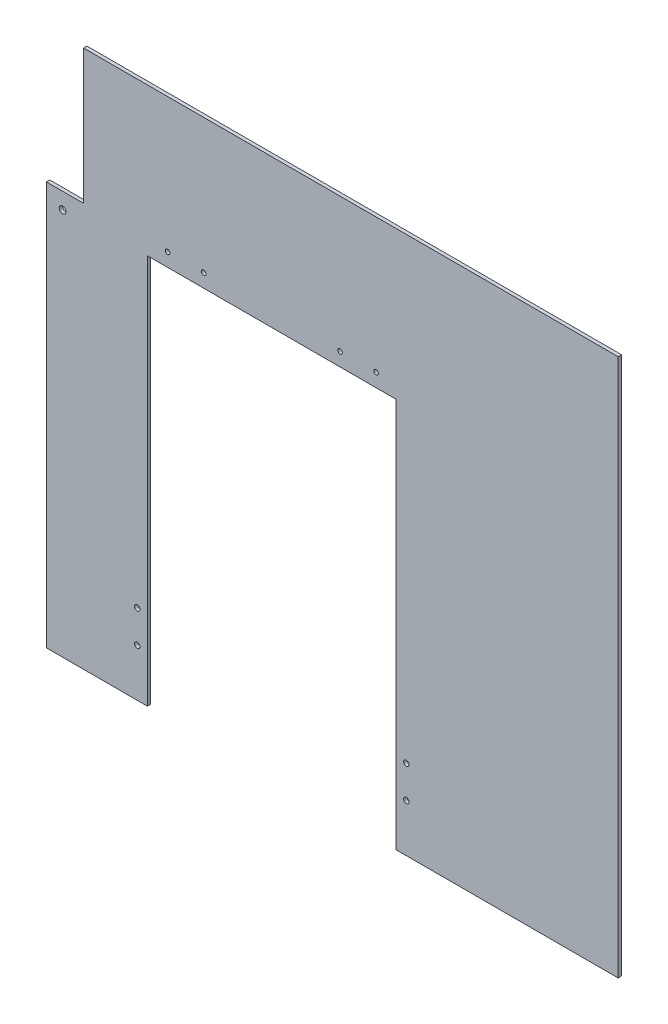
from build123d import *

# Parameters (mm, degrees)
SKETCH1_W           = 539.75
SKETCH1_H           = 508
BOSS_EXTRUDE1_DEPTH = 3.175
SKETCH2_R           = 2.54
SKETCH2_R_2         = 3.175
SKETCH2_W           = 234.95
SKETCH2_H           = 368.3
CUT_EXTRUDE1_DEPTH  = 44.45
SKETCH3_W           = 34.925
SKETCH3_H           = 127
CUT_EXTRUDE2_DEPTH  = 742.218013222
SKETCH4_R           = 2.159
CUT_EXTRUDE3_DEPTH  = 742.218013222


with BuildPart() as part:
    # Sketch1 → Boss-Extrude1 (new body)
    with BuildSketch(Plane.XY):
        with Locations((269.875, 254)):
            Rectangle(SKETCH1_W, SKETCH1_H)
    extrude(amount=BOSS_EXTRUDE1_DEPTH)

    # Sketch2 → Cut-Extrude1 (cut)
    with BuildSketch(Plane(origin=(0, 0, 0), x_dir=(-1, 0, 0), z_dir=(0, 0, -1))):
        with Locations((-339.725, 45.085)):
            Circle(SKETCH2_R)
        with Locations((-85.725, 45.085)):
            Circle(SKETCH2_R)
        with Locations((-15.24, 365.76)):
            Circle(SKETCH2_R_2)
        with Locations((-339.725, 75.565)):
            Circle(SKETCH2_R)
        with Locations((-85.725, 75.565)):
            Circle(SKETCH2_R)
        with Locations((-212.725, 184.15)):
            Rectangle(SKETCH2_W, SKETCH2_H)
    extrude(amount=-CUT_EXTRUDE1_DEPTH, mode=Mode.SUBTRACT)

    # Sketch3 → Cut-Extrude2 (cut, through all)
    with BuildSketch(Plane(origin=(0, 0, 0), x_dir=(-1, 0, 0), z_dir=(0, 0, -1))):
        with Locations((-17.4625, 444.5)):
            Rectangle(SKETCH3_W, SKETCH3_H)
    extrude(amount=-CUT_EXTRUDE2_DEPTH, mode=Mode.SUBTRACT)

    # Sketch4 → Cut-Extrude3 (cut, through all)
    with BuildSketch(Plane(origin=(0, 0, 0), x_dir=(-1, 0, 0), z_dir=(0, 0, -1))):
        with Locations((-311.1754, 381)):
            Circle(SKETCH4_R)
        with Locations((-277.1394, 381)):
            Circle(SKETCH4_R)
        with Locations((-148.3614, 381)):
            Circle(SKETCH4_R)
        with Locations((-114.3254, 381)):
            Circle(SKETCH4_R)
    extrude(amount=-CUT_EXTRUDE3_DEPTH, mode=Mode.SUBTRACT)


solid = part.part
